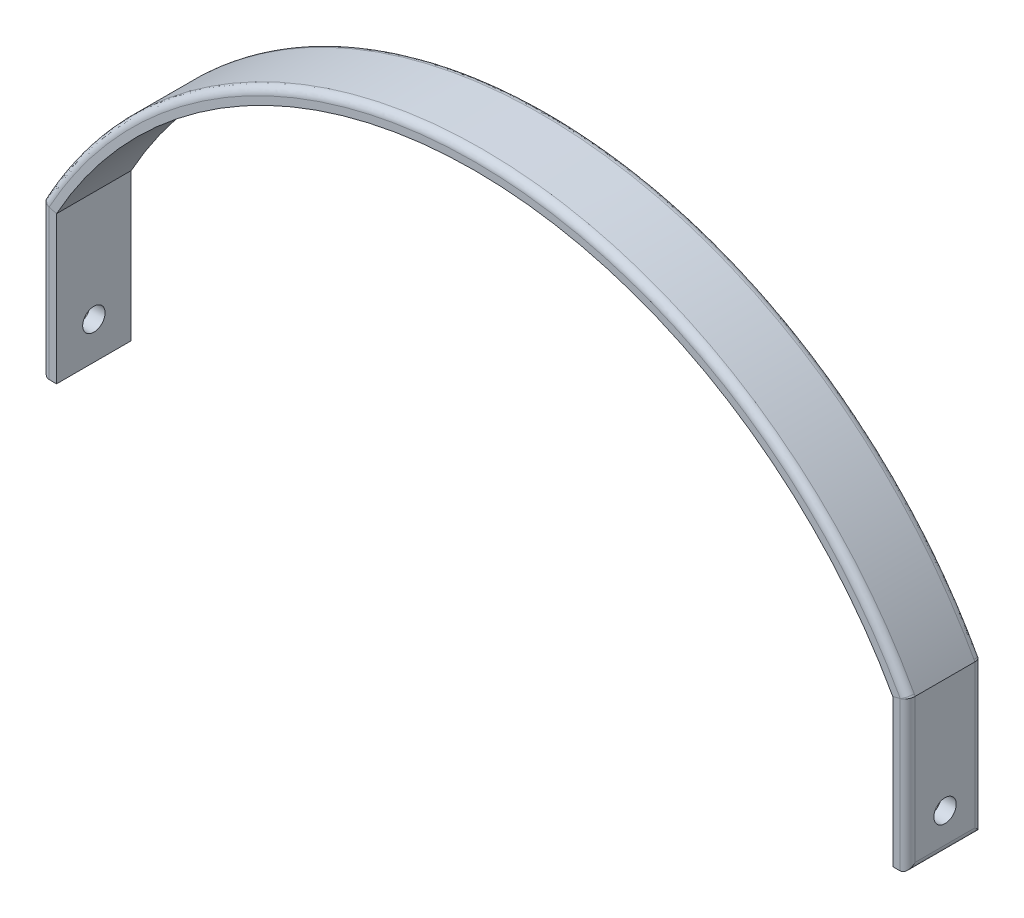
from build123d import *

# Parameters (mm, degrees)
WYCI_GNI_CIE_START            = -5
WYCI_GNI_CIE_PO_CIE_CE1_DEPTH = 10
SZKIC4_R                      = 1.5
WYTNIJ_WYCI_GNI_CIE1_DEPTH    = 122.198961231
ZAOKR_GLENIE10_R              = 1


# Read off the part's stored shape, not the designer's step: Wyciągnięcie po ścieżce1
with BuildPart() as part:
    # Wyciągnięcie po ścieżce1 outline → Wyciągnięcie po ścieżce1 (new body)
    with BuildSketch(Plane.XY.offset(WYCI_GNI_CIE_START)):
        with BuildLine():
            Line((56, -20), (58, -20))
            Line((58, -20), (58.000000005, 0.256073975))
            add(Edge.make_bspline(
                [(-58.000000005, 0.256073975), (-57.959059345, 0.330771486), (-57.918282901, 0.405169387), (-56.474074193, 3.040140831), (-54.877268633, 5.543975998), (-51.388049557, 10.279084861), (-49.485028704, 12.529778036), (-43.351264116, 18.871512194), (-38.693926137, 22.549111253), (-28.57229802, 28.543778915), (-23.1088667, 30.860338873), (-11.763148154, 33.96808191), (-5.881823614, 34.759001296), (5.881823614, 34.759001296), (11.763148154, 33.96808191), (23.1088667, 30.860338873), (28.57229802, 28.543778915), (38.693926136, 22.549111253), (43.351264116, 18.871512194), (49.485028704, 12.529778036), (51.388049557, 10.27908486), (54.877268633, 5.543975998), (56.474074193, 3.040140831), (57.918282901, 0.405169387), (57.959059345, 0.330771486), (58.000000005, 0.256073975)],
                knots=[-0.001842671, -0.001842671, -0.001842671, -0.001842671, 0, 0, 0.0625, 0.0625, 0.125, 0.125, 0.25, 0.25, 0.375, 0.375, 0.5, 0.5, 0.625, 0.625, 0.75, 0.75, 0.875, 0.875, 0.9375, 0.9375, 1, 1, 1.001842671, 1.001842671, 1.001842671, 1.001842671], degree=3))
            Line((-58.000000005, 0.256073975), (-58, -20))
            Line((-58, -20), (-56, -20))
            Line((-56, -20), (-56, -0.257131934))
            ThreePointArc((-56, -0.257131934), (0, 32.759001296), (56, -0.257131934))
            Line((56, -0.257131934), (56, -20))
        make_face()
    extrude(amount=WYCI_GNI_CIE_PO_CIE_CE1_DEPTH)

    # Szkic4 → Wytnij-wyciągnięcie1 (cut, through all)
    with BuildSketch(Plane(origin=(58, 0, 0), x_dir=(0, 0, -1), z_dir=(1, 0, 0))):
        with Locations((0, -15)):
            Circle(SZKIC4_R)
    extrude(amount=-WYTNIJ_WYCI_GNI_CIE1_DEPTH, mode=Mode.SUBTRACT)

    # Zaokrąglenie10
    zaokr_glenie10_edges = [part.edges().sort_by_distance(p)[0] for p in [
        (-58, -20, 0),
        (0, 34.759001296, -5),
        (0, 34.759001296, 5),
        (0, 34.759001296, -5),
        (0, 34.759001296, 5),
        (-58.000000003, -9.871963013, 5),
        (58, -20, 0),
        (58.000000003, -9.871963013, -5),
        (58.000000003, -9.871963013, 5),
        (-58.000000003, -9.871963013, -5),
    ]]
    fillet(zaokr_glenie10_edges, radius=ZAOKR_GLENIE10_R)


solid = part.part
